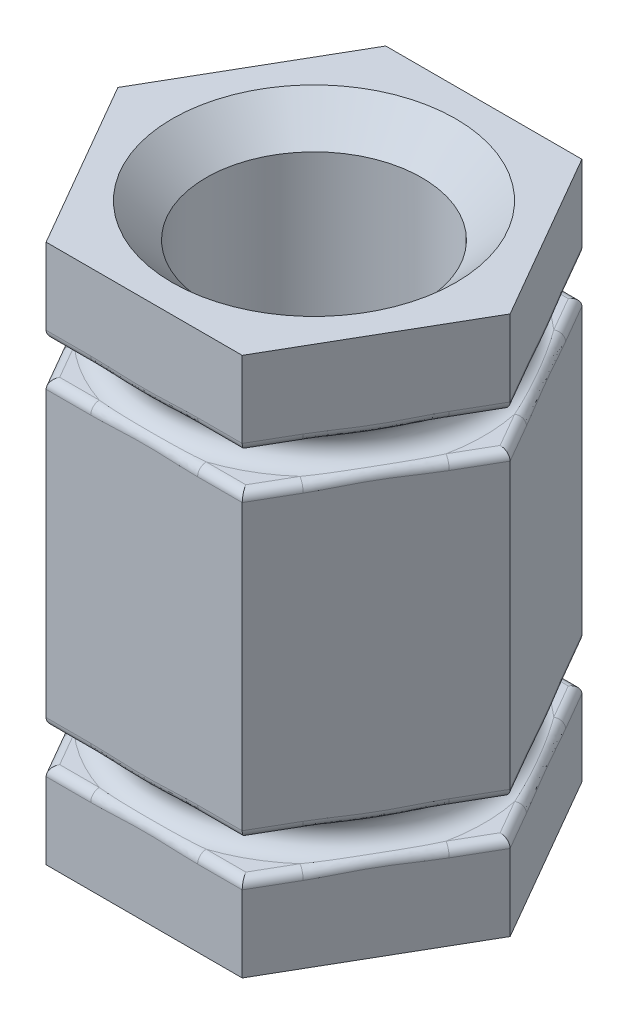
from build123d import *

# Parameters (mm, degrees)
SKETCH1_R           = 3.175
BOSS_EXTRUDE1_DEPTH = 15.875
FILLET1_R           = 0.254
SKETCH3_R           = 1.025
CUT_EXTRUDE1_DEPTH  = 10
CHAMFER1_SIZE       = 1
CHAMFER2_SIZE       = 0.25


with BuildPart() as part:
    # Sketch1 → Boss-Extrude1 (new body)
    with BuildSketch(Plane(origin=(0, 0, 0), x_dir=(1, 0, 0), z_dir=(0, 1, 0))):
        Polygon((-5.773502692, 0), (-2.886751346, -5), (2.886751346, -5), (5.773502692, 0), (2.886751346, 5), (-2.886751346, 5), align=None)
        Circle(SKETCH1_R, mode=Mode.SUBTRACT)
    extrude(amount=BOSS_EXTRUDE1_DEPTH)

    # Sketch2 → Cut-Revolve1 (revolve, cut)
    with BuildSketch(Plane.XY):
        with BuildLine():
            Line((-5, 13.375), (-6.773502692, 13.375))
            Line((-6.773502692, 13.375), (-6.773502692, 12.375))
            Line((-6.773502692, 12.375), (-5, 12.375))
            ThreePointArc((-5, 12.375), (-4.5, 12.875), (-5, 13.375))
        make_face()
        with BuildLine():
            Line((-5, 3.5), (-6.773502692, 3.5))
            Line((-6.773502692, 3.5), (-6.773502692, 2.5))
            Line((-6.773502692, 2.5), (-5, 2.5))
            ThreePointArc((-5, 2.5), (-4.5, 3), (-5, 3.5))
        make_face()
    revolve(axis=Axis((0, 15.875, 0), (0, -1, 0)), mode=Mode.SUBTRACT)

    # Fillet1
    fillet1_edges = [part.edges().sort_by_distance(p)[0] for p in [
        (5.051814855, 2.5, -1.25),
        (1.443375673, 2.5, -5),
        (-5.051814855, 2.5, -1.25),
        (-3.608439182, 2.5, 3.75),
        (5.051814855, 2.5, 1.25),
        (1.443375673, 2.5, 5),
        (-3.608439182, 3.5, 3.75),
        (-1.443375673, 3.5, 5),
        (5.051814855, 3.5, 1.25),
        (5.051814855, 3.5, -1.25),
        (1.443375673, 3.5, -5),
        (-5.051814855, 3.5, -1.25),
        (-5.051814855, 13.375, -1.25),
        (-1.443375673, 13.375, -5),
        (3.608439182, 13.375, -3.75),
        (5.051814855, 13.375, 1.25),
        (1.443375673, 13.375, 5),
        (-5.051814855, 13.375, 1.25),
        (-5.051814855, 12.375, 1.25),
        (-1.443375673, 12.375, 5),
        (3.608439182, 12.375, 3.75),
        (5.051814855, 12.375, -1.25),
        (1.443375673, 12.375, -5),
        (-3.608439182, 12.375, -3.75),
        (3.608439182, 2.5, -3.75),
        (-1.443375673, 2.5, -5),
        (-3.608439182, 2.5, -3.75),
        (-5.051814855, 2.5, 1.25),
        (3.608439182, 2.5, 3.75),
        (-1.443375673, 2.5, 5),
        (-5.051814855, 3.5, 1.25),
        (1.443375673, 3.5, 5),
        (3.608439182, 3.5, 3.75),
        (3.608439182, 3.5, -3.75),
        (-1.443375673, 3.5, -5),
        (-3.608439182, 3.5, -3.75),
        (-3.608439182, 13.375, -3.75),
        (1.443375673, 13.375, -5),
        (5.051814855, 13.375, -1.25),
        (3.608439182, 13.375, 3.75),
        (-1.443375673, 13.375, 5),
        (-3.608439182, 13.375, 3.75),
        (-3.608439182, 12.375, 3.75),
        (1.443375673, 12.375, 5),
        (5.051814855, 12.375, 1.25),
        (3.608439182, 12.375, -3.75),
        (-1.443375673, 12.375, -5),
        (-5.051814855, 12.375, -1.25),
    ]]
    fillet(fillet1_edges, radius=FILLET1_R)

    # Sketch3 → Cut-Extrude1 (cut)
    with BuildSketch(Plane.XY):
        with Locations((0, 9.875)):
            Circle(SKETCH3_R)
    extrude(amount=-CUT_EXTRUDE1_DEPTH, mode=Mode.SUBTRACT)

    # Chamfer1
    chamfer1_edges = [part.edges().sort_by_distance(p)[0] for p in [
        (-3.175, 0, 0),
        (-3.175, 15.875, 0),
    ]]
    chamfer(chamfer1_edges, length=CHAMFER1_SIZE)

    # Chamfer2
    chamfer2_edges = [part.edges().sort_by_distance(p)[0] for p in [
        (-1.025, 9.875, -5),
    ]]
    chamfer(chamfer2_edges, length=CHAMFER2_SIZE)


solid = part.part
